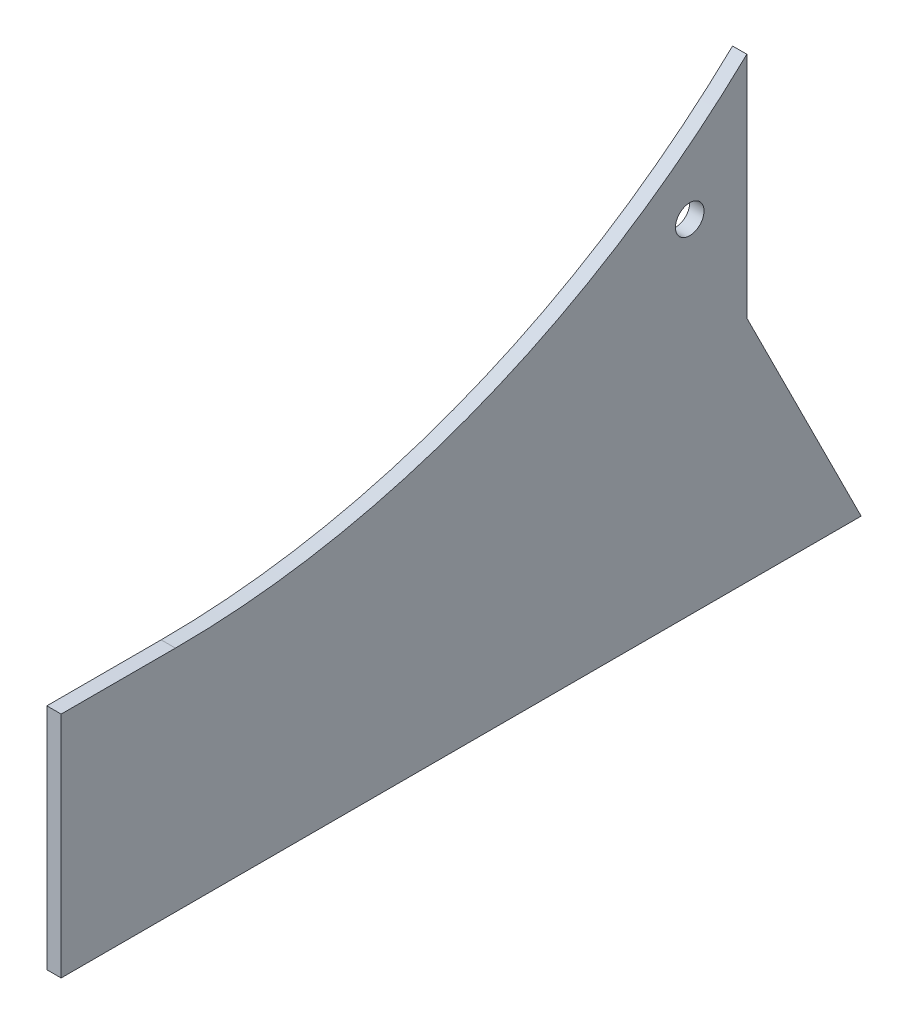
from build123d import *

# Parameters (mm, degrees)
BOSS_EXTRUDE1_DEPTH = 6.35
SKETCH2_R           = 6.35
CUT_EXTRUDE1_DEPTH  = 6.35


with BuildPart() as part:
    # Sketch1 → Boss-Extrude1 (new body)
    with BuildSketch(Plane(origin=(0, 0, 0), x_dir=(0, 0, -1), z_dir=(1, 0, 0))):
        with BuildLine():
            ThreePointArc((127, 152.4), (9.783186101, 77.142034747), (-127, 50.8))
            Line((-127, 50.8), (-177.8, 50.8))
            Line((-177.8, 50.8), (-177.8, -50.8))
            Line((-177.8, -50.8), (177.8, -50.8))
            Line((177.8, -50.8), (127, 50.8))
            Line((127, 50.8), (127, 152.4))
        make_face()
    extrude(amount=BOSS_EXTRUDE1_DEPTH)

    # Sketch2 → Cut-Extrude1 (cut)
    with BuildSketch(Plane(origin=(6.35, 0, 0), x_dir=(0, 0, -1), z_dir=(1, 0, 0))):
        with Locations((101.6, 101.6)):
            Circle(SKETCH2_R)
    extrude(amount=-CUT_EXTRUDE1_DEPTH, mode=Mode.SUBTRACT)


solid = part.part
